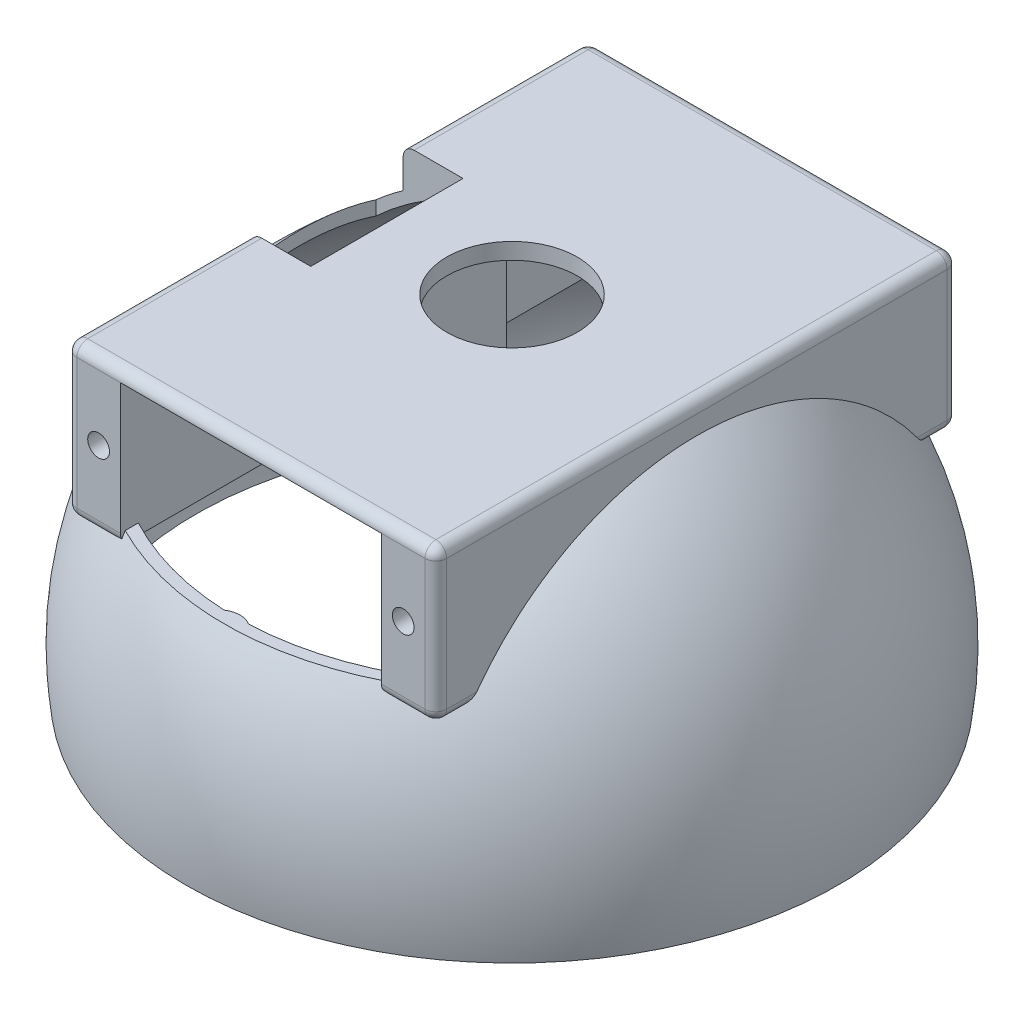
from build123d import *

# Parameters (mm, degrees)
BOSS_EXTRUDE2_START            = 9
BOSS_EXTRUDE2_DEPTH            = 15
BOSS_EXTRUDE4_START            = -9
BOSS_EXTRUDE4_DEPTH            = 15
SKETCH2_R                      = 13.165
CUT_EXTRUDE1_DEPTH             = 35
BOSS_EXTRUDE1_REACH            = 55.473
BOSS_EXTRUDE1_END_RADIUS       = 29.361673464
SKETCH3_R                      = 2
SKETCH4_R                      = 1.15
CUT_EXTRUDE2_DEPTH             = 6
CUT_EXTRUDE3_START             = -5
SKETCH7_W                      = 24
SKETCH7_H                      = 12
CUT_EXTRUDE3_DEPTH             = 33
CUT_EXTRUDE4_START             = 5
SKETCH8_W                      = 24
SKETCH8_H                      = 12
CUT_EXTRUDE4_DEPTH             = 33
BOSS_EXTRUDE5_DEPTH            = 18
BOSS_EXTRUDE6_DEPTH            = 18
FILLET4_R                      = 1
FILLET5_R                      = 1
FILLET6_R                      = 1
SKETCH18_R                     = 15.5
SKETCH18_R_2                   = 6
BOSS_EXTRUDE7_DEPTH            = 1.5
FILLET7_R                      = 1
SKETCH19_R                     = 1
CUT_EXTRUDE5_DEPTH             = 10
CUT_EXTRUDE6_START             = -10
SKETCH20_R                     = 1
CUT_EXTRUDE6_DEPTH             = 10
SKETCH21_W                     = 2
SKETCH21_H                     = 8
CUT_EXTRUDE7_DEPTH             = 10
BOSS_EXTRUDE10_REACH           = 49.934
SKETCH24_W                     = 5
SKETCH24_H                     = 12
SKETCH24_R                     = 1.1
CUT_EXTRUDE8_REACH             = 54.589
SKETCH25_W                     = 8
SKETCH25_H                     = 14
CUT_EXTRUDE8_DIRECTION_2_DEPTH = 53.589349268


with BuildPart() as part:
    # Sketch1 → Revolve1 (revolve)
    with BuildSketch(Plane.XY):
        with BuildLine():
            Line((0, 0), (0, 34.5))
            ThreePointArc((0, 34.5), (22.859625981, 24.084457375), (30, 0))
            Line((30, 0), (29.058785995, 0))
            ThreePointArc((29.058785995, 0), (22.841290394, 22.656001996), (2, 33.5))
            Line((2, 33.5), (2, 0))
            Line((2, 0), (0, 0))
        make_face()
    revolve(axis=Axis((0, 0, 0), (0, 1, 0)))

    # Sketch9 → Boss-Extrude2 (add)
    with BuildSketch(Plane.XY.offset(BOSS_EXTRUDE2_START)):
        Polygon((-12, 31), (-12, 18), (-17, 18), (-17, 32), (17, 32), (17, 18), (12, 18), (12, 31), align=None)
    extrude(amount=BOSS_EXTRUDE2_DEPTH)

    # Sketch10 → Boss-Extrude4 (add)
    with BuildSketch(Plane.XY.offset(BOSS_EXTRUDE4_START)):
        Polygon((12, 31), (12, 18), (17, 18), (17, 32), (-17, 32), (-17, 18), (-12, 18), (-12, 31), align=None)
    extrude(amount=-BOSS_EXTRUDE4_DEPTH)

    # Sketch2 → Cut-Extrude1 (cut)
    with BuildSketch(Plane.XZ):
        with Locations(Location((0, 0, 0), (0, 0, 270))):
            Circle(SKETCH2_R)
    extrude(amount=-CUT_EXTRUDE1_DEPTH, mode=Mode.SUBTRACT)

    # Boss-Extrude1: up to this sphere (the profile starts inside it)
    boss_extrude1_end = Location((0, 4.206521739, 0)) * Sphere(BOSS_EXTRUDE1_END_RADIUS, mode=Mode.PRIVATE)
    # Sketch3 → Boss-Extrude1 (add, up to the surface)
    with BuildSketch(Plane.XZ, mode=Mode.PRIVATE) as boss_extrude1_sk1:
        with Locations(Location((0, -27, 0), (0, 0, 270))):
            Circle(SKETCH3_R)
    boss_extrude1_tool1 = extrude(boss_extrude1_sk1.sketch, amount=-BOSS_EXTRUDE1_REACH, mode=Mode.PRIVATE) & boss_extrude1_end
    add(boss_extrude1_tool1.solids().sort_by_distance((0, 0, -27))[0])
    # Sketch3 → Boss-Extrude1 (add, up to the surface)
    with BuildSketch(Plane.XZ, mode=Mode.PRIVATE) as boss_extrude1_sk2:
        with Locations(Location((0, 27, 0), (0, 0, 270))):
            Circle(SKETCH3_R)
    boss_extrude1_tool2 = extrude(boss_extrude1_sk2.sketch, amount=-BOSS_EXTRUDE1_REACH, mode=Mode.PRIVATE) & boss_extrude1_end
    add(boss_extrude1_tool2.solids().sort_by_distance((0, 0, 27))[0])

    # Sketch4 → Cut-Extrude2 (cut)
    with BuildSketch(Plane.XZ):
        with Locations(Location((0, -27, 0), (0, 0, 270))):
            Circle(SKETCH4_R)
        with Locations(Location((0, 27, 0), (0, 0, 270))):
            Circle(SKETCH4_R)
    extrude(amount=-CUT_EXTRUDE2_DEPTH, mode=Mode.SUBTRACT)

    # Sketch7 → Cut-Extrude3 (cut)
    with BuildSketch(Plane.XY.offset(CUT_EXTRUDE3_START)):
        with Locations((0, 25)):
            Rectangle(SKETCH7_W, SKETCH7_H)
    extrude(amount=-CUT_EXTRUDE3_DEPTH, mode=Mode.SUBTRACT)

    # Sketch8 → Cut-Extrude4 (cut)
    with BuildSketch(Plane.XY.offset(CUT_EXTRUDE4_START)):
        with Locations((0, 25)):
            Rectangle(SKETCH8_W, SKETCH8_H)
    extrude(amount=CUT_EXTRUDE4_DEPTH, mode=Mode.SUBTRACT)

    # Fillet4
    fillet4_edges = [part.edges().sort_by_distance(p)[0] for p in [
        (17, 32, 16.5),
        (-17, 32, 16.5),
        (17, 25, 24),
        (0, 32, 24),
        (-17, 25, 24),
        (-17, 25, -24),
        (0, 32, -24),
        (-17, 32, -16.5),
        (17, 25, -24),
        (17, 32, -16.5),
    ]]
    fillet(fillet4_edges, radius=FILLET4_R - 0.0001)  # a hair under: the kernel refuses the full size



with BuildPart() as body_2:
    # Sketch13 → Boss-Extrude5 (new body)
    with BuildSketch(Plane.XY.offset(-9)):
        with BuildLine():
            Line((-9.599107101, 32), (-17, 32))
            Line((-17, 32), (-17, 27.609402441))
            add(Edge.make_bspline(
                [(-17, 27.609402441), (-13.403187995, 29.978444041), (-9.599107101, 32)],
                knots=[0, 0, 0, 1, 1, 1], degree=2))
        make_face()
    extrude(amount=BOSS_EXTRUDE5_DEPTH)

    # Fillet5
    fillet5_edges = [body_2.edges().sort_by_distance(p)[0] for p in [
        (-17, 32, 0),
    ]]
    fillet(fillet5_edges, radius=FILLET5_R)


with BuildPart() as body_3:
    # Sketch14 → Boss-Extrude6 (new body)
    with BuildSketch(Plane.XY.offset(-9)):
        with BuildLine():
            Line((17, 27.609402441), (17, 32))
            Line((17, 32), (9.599107101, 32))
            add(Edge.make_bspline(
                [(17, 27.609402441), (13.36301326, 29.911897306), (9.599107101, 32)],
                knots=[0, 0, 0, 1, 1, 1], degree=2))
        make_face()
    extrude(amount=BOSS_EXTRUDE6_DEPTH)

    # Fillet6
    fillet6_edges = [body_3.edges().sort_by_distance(p)[0] for p in [
        (17, 32, 0),
    ]]
    fillet(fillet6_edges, radius=FILLET6_R)


with BuildPart() as part_1:
    add(part.part)

    add(body_2.part)  # Boss-Extrude7 merges body 2

    add(body_3.part)  # Boss-Extrude7 merges body 3
    # Sketch18 → Boss-Extrude7 (add)
    with BuildSketch(Plane(origin=(0, 32, 0), x_dir=(1, 0, 0), z_dir=(0, 1, 0))):
        Circle(SKETCH18_R)
        with Locations(Location((0, 0, 0), (0, 0, 180))):
            Circle(SKETCH18_R_2, mode=Mode.SUBTRACT)
    extrude(amount=-BOSS_EXTRUDE7_DEPTH)

    # Fillet7
    fillet7_edges = [part_1.edges().sort_by_distance(p)[0] for p in [
        (17, 18, -21.969467159),
        (-14.152992032, 18, -24),
        (-17, 18, -21.969467159),
        (-17, 18, 21.969467159),
        (-14.152992032, 18, 24),
        (17, 18, 21.969467159),
        (14.152992032, 18, 24),
        (14.152992032, 18, -24),
        (16.707136071, 18, -23.707136071),
        (-16.707136071, 18, -23.707136071),
        (-16.707136071, 18, 23.707136071),
        (16.707136071, 18, 23.707136071),
    ]]
    fillet(fillet7_edges, radius=FILLET7_R - 0.0001)  # a hair under: the kernel refuses the full size

    # Sketch19 → Cut-Extrude5 (cut)
    with BuildSketch(Plane.XY.offset(24)):
        with Locations((14, 25)):
            Circle(SKETCH19_R)
        with Locations((-14, 25)):
            Circle(SKETCH19_R)
    extrude(amount=-CUT_EXTRUDE5_DEPTH, mode=Mode.SUBTRACT)

    # Sketch20 → Cut-Extrude6 (cut)
    with BuildSketch(Plane(origin=(0, 0, -24), x_dir=(-1, 0, 0), z_dir=(0, 0, -1)).offset(CUT_EXTRUDE6_START)):
        with Locations(Location((-14, 25, 0), (0, 0, 180))):
            Circle(SKETCH20_R)
        with Locations(Location((14, 25, 0), (0, 0, 180))):
            Circle(SKETCH20_R)
    extrude(amount=CUT_EXTRUDE6_DEPTH, mode=Mode.SUBTRACT)

    # Sketch21 → Cut-Extrude7 (cut)
    with BuildSketch(Plane.XZ.offset(-18)):
        with Locations((13, 13)):
            Rectangle(SKETCH21_W, SKETCH21_H)
        with Locations((13, -13)):
            Rectangle(SKETCH21_W, SKETCH21_H)
    extrude(amount=-CUT_EXTRUDE7_DEPTH, mode=Mode.SUBTRACT)

    # Sketch24 → Boss-Extrude10 (add, up to next)
    with BuildSketch(Plane(origin=(0, 21.5, 0), x_dir=(-1, 0, 0), z_dir=(0, -1, 0)), mode=Mode.PRIVATE) as boss_extrude10_sk1:
        with Locations((-20, 0)):
            Rectangle(SKETCH24_W, SKETCH24_H)
        with Locations(Location((-20, 0, 0), (0, 0, 180))):
            Circle(SKETCH24_R, mode=Mode.SUBTRACT)
    boss_extrude10_tool1 = extrude(boss_extrude10_sk1.sketch, amount=-BOSS_EXTRUDE10_REACH, mode=Mode.PRIVATE) - part_1.part
    # Sketch24 → Boss-Extrude10 (add, up to next)
    with BuildSketch(Plane(origin=(0, 21.5, 0), x_dir=(-1, 0, 0), z_dir=(0, -1, 0)), mode=Mode.PRIVATE) as boss_extrude10_sk2:
        with Locations((9, 0)):
            Rectangle(SKETCH24_W, SKETCH24_H)
        with Locations(Location((9, 0, 0), (0, 0, 180))):
            Circle(SKETCH24_R, mode=Mode.SUBTRACT)
    boss_extrude10_tool2 = extrude(boss_extrude10_sk2.sketch, amount=-BOSS_EXTRUDE10_REACH, mode=Mode.PRIVATE) - part_1.part
    add(boss_extrude10_tool1.solids().sort_by_distance((20, 21.5, 5.87))[0])
    add(boss_extrude10_tool2.solids().sort_by_distance((-9, 21.5, 5.87))[0])

    # Sketch25 → Cut-Extrude8 (cut, up to next)
    with BuildSketch(Plane.XZ.offset(-30.5), mode=Mode.PRIVATE) as cut_extrude8_sk1:
        with Locations((-15.5, 0)):
            Rectangle(SKETCH25_W, SKETCH25_H)
    cut_extrude8_tool1 = extrude(cut_extrude8_sk1.sketch, amount=CUT_EXTRUDE8_REACH, mode=Mode.PRIVATE) & part_1.part
    add(cut_extrude8_tool1.solids().sort_by_distance((-15.5, 30.5, 0))[0], mode=Mode.SUBTRACT)

    # Sketch25 → Cut-Extrude8 direction 2 (cut)
    with BuildSketch(Plane.XZ.offset(-30.5)):
        with Locations((-15.5, 0)):
            Rectangle(SKETCH25_W, SKETCH25_H)
    extrude(amount=-CUT_EXTRUDE8_DIRECTION_2_DEPTH, mode=Mode.SUBTRACT)


solid = part_1.part
